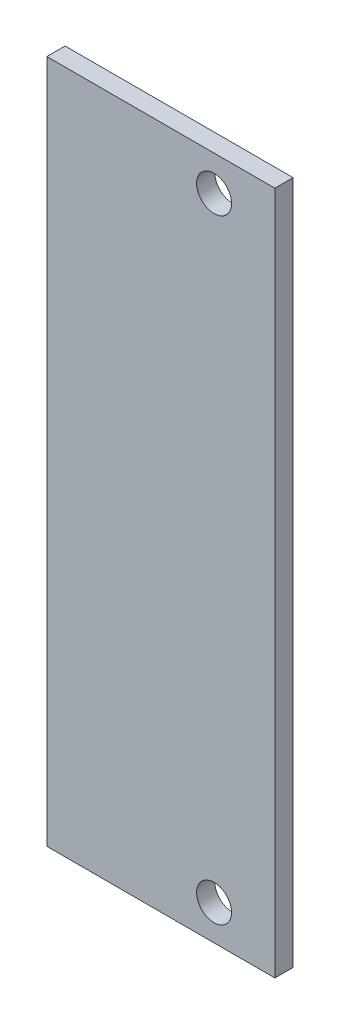
from build123d import *

# Parameters (mm, degrees)
SKETCH_1_W      = 45
SKETCH_1_H      = 8
SKETCH_1_R      = 1.15
EXTRUDE_1_DEPTH = 1.2
SKETCH_3_W      = 45
SKETCH_3_H      = 1.2
EXTRUDE_2_DEPTH = 7


with BuildPart() as part:
    # ｽｹｯﾁ1 → ﾎﾞｽ - 押し出し1 (new body)
    with BuildSketch(Plane(origin=(0, 0, 0), x_dir=(0, 1, 0), z_dir=(0, 0, 1))):
        with Locations((22.5, 4)):
            Rectangle(SKETCH_1_W, SKETCH_1_H)
        with Locations((2.3, 4)):
            Circle(SKETCH_1_R, mode=Mode.SUBTRACT)
        with Locations((42.7, 4)):
            Circle(SKETCH_1_R, mode=Mode.SUBTRACT)
    extrude(amount=-EXTRUDE_1_DEPTH)

    # ｽｹｯﾁ3 → ﾎﾞｽ - 押し出し2 (add)
    with BuildSketch(Plane(origin=(-8, 0, 0), x_dir=(0, -1, 0), z_dir=(-1, 0, 0))):
        with Locations((-22.5, -0.6)):
            Rectangle(SKETCH_3_W, SKETCH_3_H)
    extrude(amount=EXTRUDE_2_DEPTH)


solid = part.part
